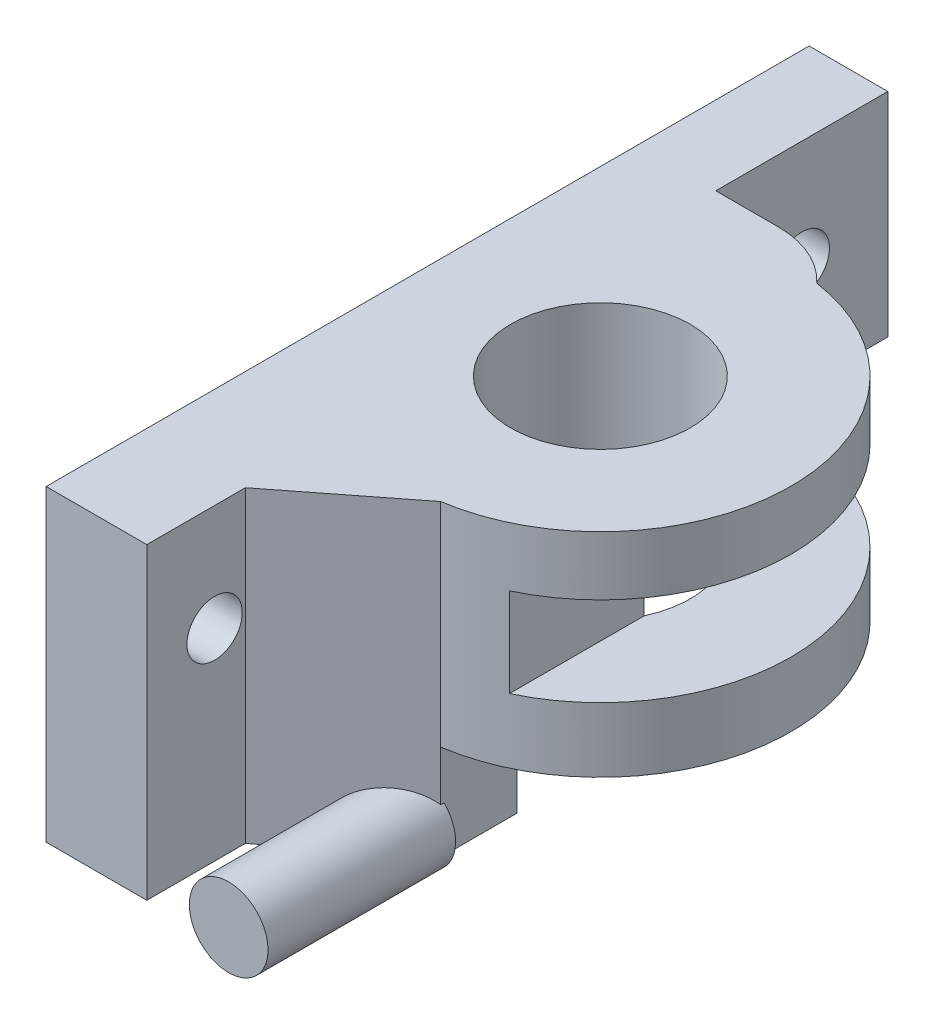
from build123d import *

# Parameters (mm, degrees)
SKETCH_1_R                = 20.68
SKETCH_1_R_2              = 9.68
EXTRUDE_1_DEPTH           = 116.68
SKETCH_11_W               = 27
SKETCH_11_H               = 150
CUT_EXTRUDE_3_DEPTH       = 40
SKETCH_13_W               = 10
SKETCH_13_H               = 128.345013401
CUT_EXTRUDE_7_DEPTH       = 126.614916312
SKETCH_15_W               = 8
SKETCH_15_H               = 68.68
CUT_EXTRUDE_9_DEPTH       = 48
SKETCH_16_W               = 15.549431524
SKETCH_16_H               = 20
SKETCH_16_W_2             = 15.459431524
EXTRUDE_4_DEPTH           = 19.2
SKETCH_17_W               = 19.20851187
SKETCH_17_H               = 14.03
CUT_EXTRUDE_10_DEPTH      = 20.2
SKETCH_18_R               = 9.59
CUT_EXTRUDE_11_DEPTH      = 121.289430957
SKETCH_21_R               = 2.985
CUT_EXTRUDE_12_DEPTH      = 55.2
EXTRUDE_START             = 55.2
SKETCH_24_R               = 20.59
SKETCH_24_R_2             = 9.59
EXTRUDE_2_DEPTH           = 55.2
CUT_EXTRUDE_13_DEPTH      = 55.2
SKETCH_26_W               = 10.00851187
SKETCH_26_H               = 41.68
CUT_EXTRUDE_15_DEPTH      = 55.2
SKETCH_27_W               = 10
SKETCH_27_H               = 40
CUT_EXTRUDE_16_DEPTH      = 55.2
SKETCH_28_W               = 44.880694938
SKETCH_28_H               = 9.608044066
CUT_EXTRUDE_17_DEPTH      = 12.2
SKETCH_35_W               = 13.53
SKETCH_35_H               = 20
EXTRUDE_10_DEPTH          = 15
EXTRUDE_11_DEPTH          = 15
SKETCH_37_W               = 9
SKETCH_37_H               = 20
EXTRUDE_12_DEPTH          = 20
SKETCH_38_W               = 9
SKETCH_38_H               = 20
EXTRUDE_13_DEPTH          = 20
SKETCH_42_R               = 2.985
CUT_EXTRUDE_21_DEPTH      = 20
CUT_EXTRUDE_23_DEPTH      = 138.235841092
SKETCH_45_W               = 3
SKETCH_45_H               = 20
EXTRUDE_14_DEPTH          = 30
SKETCH_46_W               = 3
SKETCH_46_H               = 20
EXTRUDE_15_DEPTH          = 30
SKETCH_47_W               = 33.078221107
SKETCH_47_H               = 20
EXTRUDE_16_DEPTH          = 50
SKETCH_48_W               = 30
SKETCH_48_H               = 20
EXTRUDE_17_DEPTH          = 50
SKETCH_50_W               = 50
SKETCH_50_H               = 20
EXTRUDE_18_DEPTH          = 1
SKETCH_51_W               = 50
SKETCH_51_H               = 20
EXTRUDE_19_DEPTH          = 1
SKETCH_52_W               = 53
SKETCH_52_H               = 14
CUT_EXTRUDE_24_DEPTH      = 151.972575738
SKETCH_53_W               = 53
SKETCH_53_H               = 14
CUT_EXTRUDE_25_DEPTH      = 151.942387436
SKETCH_54_W               = 40
SKETCH_54_H               = 73.27
CUT_EXTRUDE_26_DEPTH      = 147.866192927
SKETCH_56_W               = 13.00851187
SKETCH_56_H               = 20
EXTRUDE_21_DEPTH          = 3.08
SKETCH_60_W               = 6.504255935
SKETCH_60_H               = 76.35
CUT_EXTRUDE_30_DEPTH      = 137.106994034
CUT_EXTRUDE_32_DEPTH      = 20
SKETCH_64_W               = 16.20851187
SKETCH_64_H               = 0.09
EXTRUDE_22_DEPTH          = 20
SKETCH_65_W               = 3.495744065
SKETCH_65_H               = 3.26
CUT_EXTRUDE_33_DEPTH      = 137.057988464
SKETCH_66_W               = 3.495744065
SKETCH_66_H               = 1.776778893
SKETCH_66_W_2             = 3.503635083
SKETCH_66_H_2             = 1.775
EXTRUDE_23_DEPTH          = 20.2
SKETCH_68_W               = 6.504255935
SKETCH_68_H               = 3.66
CUT_EXTRUDE_34_DEPTH      = 20
SKETCH_69_R               = 2.985
CUT_EXTRUDE_35_DEPTH      = 126.598983893
SKETCH_70_R               = 2.985
CUT_EXTRUDE_36_DEPTH      = 132.360728238
SKETCH_71_W               = 38.005321573
SKETCH_71_H               = 111.965885132
CUT_EXTRUDE_37_DEPTH      = 147.475577566
SKETCH_72_R               = 9.7
CUT_EXTRUDE_38_DEPTH      = 38.185254838
CUT_EXTRUDE_START         = -22
SKETCH_77_R               = 30.59
SKETCH_77_R_2             = 20.59
CUT_EXTRUDE_2_DEPTH       = 22
SKETCH_78_W               = 34.816185151
SKETCH_78_H               = 22.96559116
EXTRUDE_26_DEPTH          = 0.1
SKETCH_80_W               = 2.900031179
SKETCH_80_H               = 6.148706656
EXTRUDE_28_DEPTH          = 23.1
SKETCH_81_W               = 6.148706656
SKETCH_81_H               = 23.1
EXTRUDE_29_DEPTH          = 14.1
SKETCH_82_W               = 6.148706656
SKETCH_82_H               = 0.13440884
CUT_EXTRUDE_39_DEPTH      = 19.1
SKETCH_83_W               = 2.900031179
SKETCH_83_H               = 22.96559116
EXTRUDE_30_DEPTH          = 19.1
FILLET_1_R                = 10
SKETCH_84_W               = 3.5
SKETCH_84_H               = 19.1
EXTRUDE_31_DEPTH          = 23.1
SKETCH_85_W               = 3.5
SKETCH_85_H               = 0.52
CUT_EXTRUDE_40_DEPTH      = 48.860163141
SKETCH_86_W               = 3.5
SKETCH_86_H               = 22.96559116
EXTRUDE_32_DEPTH          = 62.1
SKETCH_87_W               = 3.60851187
SKETCH_87_H               = 34.816185151
CUT_EXTRUDE_41_DEPTH      = 62.1
SKETCH_89_W               = 0.10851187
SKETCH_89_H               = 6.15
EXTRUDE_33_DEPTH          = 23.1
EXTRUDE_34_DEPTH          = 22.1
SKETCH_91_W               = 0.971561636
SKETCH_91_H               = 22.96559116
CUT_EXTRUDE_42_DEPTH      = 22.1
SKETCH_95_W               = 6.15
SKETCH_95_H               = 22.96559116
EXTRUDE_35_DEPTH          = 14.1
FILLET_2_R                = 10
SKETCH_96_W               = 3.60851187
SKETCH_96_H               = 2.548438364
CUT_EXTRUDE_43_DEPTH      = 55.35700885
SKETCH_97_W               = 3.5
SKETCH_97_H               = 6.148706656
EXTRUDE_36_DEPTH          = 23.1
CUT_EXTRUDE_44_DEPTH      = 23.1
SKETCH_99_W               = 6.15
SKETCH_99_H               = 0.13440884
CUT_EXTRUDE_45_DEPTH      = 23.1
SKETCH_101_R              = 2.985
CUT_EXTRUDE_46_DEPTH      = 23.1
SKETCH_103_W              = 3.60851187
SKETCH_103_H              = 0.54
CUT_EXTRUDE_49_DEPTH      = 53.222714265
SKETCH_104_W              = 3.60851187
SKETCH_104_H              = 0.54
CUT_EXTRUDE_50_DEPTH      = 53.222714265
SKETCH_105_W              = 14.1
SKETCH_105_H              = 22.96559116
EXTRUDE_37_DEPTH          = 30
SKETCH_106_W              = 8.260608777
SKETCH_106_H              = 22.96559116
CUT_EXTRUDE_52_DEPTH      = 61.301547389
SKETCH_107_R              = 2.985
CUT_EXTRUDE_53_DEPTH      = 54.964080882
SKETCH_108_W              = 3.60851187
SKETCH_108_H              = 22.96559116
EXTRUDE_38_DEPTH          = 40
SKETCH_109_W              = 84.280268292
SKETCH_109_H              = 22.96559116
EXTRUDE_39_DEPTH          = 5
SKETCH_110_R              = 2.985
CUT_EXTRUDE_54_DEPTH      = 57.152183688
SKETCH_111_R              = 2.985
CUT_EXTRUDE_55_DEPTH      = 50.299169813
CUT_EXTRUDE_56_DEPTH      = 53.222714265
EXTRUDE_40_DEPTH          = 10.3
EXTRUDE_44_DEPTH          = 0.01
EXTRUDE_44_DEPTH_BACK     = 30.01
SKETCH_120_R              = 4.25
CUT_EXTRUDE_58_DEPTH      = 60.346587307
CUT_EXTRUDE_58_DEPTH_BACK = 60.346587307
SKETCH_121_W              = 49.202417837
SKETCH_121_H              = 14.707819526


with BuildPart() as part:
    # 草圖1 → 伸長-薄件1 (new body)
    with BuildSketch(Plane(origin=(0, 0, 0), x_dir=(1, 0, 0), z_dir=(0, 1, 0))):
        Circle(SKETCH_1_R)
        Circle(SKETCH_1_R_2, mode=Mode.SUBTRACT)
    extrude(amount=EXTRUDE_1_DEPTH)

    # 草圖11 → 除料-伸長3 (cut)
    with BuildSketch(Plane(origin=(0, 116.68, 0), x_dir=(1, 0, 0), z_dir=(0, 1, 0))):
        with Locations((21.70851187, -44.235815192)):
            Rectangle(SKETCH_11_W, SKETCH_11_H)
    extrude(amount=-CUT_EXTRUDE_3_DEPTH, mode=Mode.SUBTRACT)

    # 草圖13 → 除料-伸長7 (cut, through all)
    with BuildSketch(Plane.XY.offset(21)):
        with Locations((-16, 58.612182466)):
            Rectangle(SKETCH_13_W, SKETCH_13_H)
    extrude(amount=-CUT_EXTRUDE_7_DEPTH, mode=Mode.SUBTRACT)

    # 草圖15 → 除料-伸長9 (cut)
    with BuildSketch(Plane.XY.offset(21)):
        with Locations((-1.395744065, 52.34)):
            Rectangle(SKETCH_15_W, SKETCH_15_H)
    extrude(amount=-CUT_EXTRUDE_9_DEPTH, mode=Mode.SUBTRACT)

    # 草圖16 → 填料-伸長4 (add)
    with BuildSketch(Plane(origin=(8.20851187, 0, 0), x_dir=(0, 0, -1), z_dir=(1, 0, 0))):
        with Locations((12.905284238, 106.68)):
            Rectangle(SKETCH_16_W, SKETCH_16_H)
        with Locations((-12.860284238, 106.68)):
            Rectangle(SKETCH_16_W_2, SKETCH_16_H)
    extrude(amount=-EXTRUDE_4_DEPTH)

    # 草圖17 → 除料-伸長10 (cut)
    with BuildSketch(Plane(origin=(0, 116.68, 0), x_dir=(1, 0, 0), z_dir=(0, 1, 0))):
        with Locations((-1.395744065, -0.045)):
            Rectangle(SKETCH_17_W, SKETCH_17_H)
    extrude(amount=-CUT_EXTRUDE_10_DEPTH, mode=Mode.SUBTRACT)

    # 草圖18 → 除料-伸長11 (cut, through all)
    with BuildSketch(Plane.XZ):
        with Locations(Location((0, 0, 0), (0, 0, 90))):
            Circle(SKETCH_18_R)
    extrude(amount=-CUT_EXTRUDE_11_DEPTH, mode=Mode.SUBTRACT)

    # 草圖21 → 除料-伸長12 (cut)
    with BuildSketch(Plane(origin=(0, 0, -20.68), x_dir=(-1, 0, 0), z_dir=(0, 0, -1))):
        with Locations((1.39148813, 108.73)):
            Circle(SKETCH_21_R)
    extrude(amount=-CUT_EXTRUDE_12_DEPTH, mode=Mode.SUBTRACT)

    # 草圖24 → 伸長-薄件2 (add)
    with BuildSketch(Plane.XZ.offset(EXTRUDE_START)):
        Circle(SKETCH_24_R)
        Circle(SKETCH_24_R_2, mode=Mode.SUBTRACT)
    extrude(amount=-EXTRUDE_2_DEPTH)

    # 草圖25 → 除料-伸長13 (cut)
    with BuildSketch(Plane.XY.offset(21)):
        Polygon((-1.39148813, -11.785), (22.612379708, -11.785), (22.612379708, -63.873337429), (-22.749525245, -63.873337429), (-22.749525245, -11.785), align=None)
    extrude(amount=-CUT_EXTRUDE_13_DEPTH, mode=Mode.SUBTRACT)

    # 草圖26 → 除料-伸長15 (cut)
    with BuildSketch(Plane(origin=(0, 0, 0), x_dir=(1, 0, 0), z_dir=(0, 1, 0))):
        with Locations((-15.995744065, -0.16)):
            Rectangle(SKETCH_26_W, SKETCH_26_H)
    extrude(amount=-CUT_EXTRUDE_15_DEPTH, mode=Mode.SUBTRACT)

    # 草圖27 → 除料-伸長16 (cut)
    with BuildSketch(Plane(origin=(21, 0, 0), x_dir=(0, 0, -1), z_dir=(1, 0, 0))):
        with Locations((0, 41.68)):
            Rectangle(SKETCH_27_W, SKETCH_27_H)
    extrude(amount=-CUT_EXTRUDE_16_DEPTH, mode=Mode.SUBTRACT)

    # 草圖28 → 除料-伸長17 (cut)
    with BuildSketch(Plane(origin=(21, 0, 0), x_dir=(0, 0, -1), z_dir=(1, 0, 0))):
        Rectangle(SKETCH_28_W, SKETCH_28_H)
    extrude(amount=-CUT_EXTRUDE_17_DEPTH, mode=Mode.SUBTRACT)

    # 草圖35 → 填料-伸長10 (add)
    with BuildSketch(Plane.ZY.offset(10.99148813)):
        with Locations((13.825, 106.68)):
            Rectangle(SKETCH_35_W, SKETCH_35_H)
    extrude(amount=EXTRUDE_10_DEPTH)

    # 草圖36 → 填料-伸長11 (add)
    with BuildSketch(Plane.ZY.offset(10.99148813)):
        Polygon((-20.68, 116.68), (-6.97, 116.68), (-6.97, 96.48), (-20.68, 96.68), align=None)
    extrude(amount=EXTRUDE_11_DEPTH)

    # 草圖37 → 填料-伸長12 (add)
    with BuildSketch(Plane.XY.offset(20.59)):
        with Locations((-21.49148813, 106.68)):
            Rectangle(SKETCH_37_W, SKETCH_37_H)
    extrude(amount=EXTRUDE_12_DEPTH)

    # 草圖38 → 填料-伸長13 (add)
    with BuildSketch(Plane(origin=(0, 0, -20.68), x_dir=(-1, 0, 0), z_dir=(0, 0, -1))):
        with Locations((21.49148813, 106.68)):
            Rectangle(SKETCH_38_W, SKETCH_38_H)
    extrude(amount=EXTRUDE_13_DEPTH)

    # 草圖42 → 除料-伸長21 (cut)
    with BuildSketch(Plane(origin=(-16.99148813, 0, 0), x_dir=(0, 0, -1), z_dir=(1, 0, 0))):
        with Locations((30.68, 106.554418142)):
            Circle(SKETCH_42_R)
        with Locations((-30.395640125, 106.68)):
            Circle(SKETCH_42_R)
    extrude(amount=-CUT_EXTRUDE_21_DEPTH, mode=Mode.SUBTRACT)

    # 草圖43 → 除料-伸長23 (cut, through all)
    with BuildSketch(Plane(origin=(0, 116.68, 0), x_dir=(1, 0, 0), z_dir=(0, 1, 0))):
        Polygon((-11, 6.97), (-10.99148813, 20.68), (-10.99148813, 48.096794253), (-28.274756234, 48.096794253), (-28.274756234, -43.270506289), (-11, -43.270506289), align=None)
    extrude(amount=-CUT_EXTRUDE_23_DEPTH, mode=Mode.SUBTRACT)

    # 草圖45 → 填料-伸長14 (add)
    with BuildSketch(Plane.XY.offset(20.59)):
        with Locations((-9.5, 106.68)):
            Rectangle(SKETCH_45_W, SKETCH_45_H)
    extrude(amount=EXTRUDE_14_DEPTH)

    # 草圖46 → 填料-伸長15 (add)
    with BuildSketch(Plane(origin=(0, 0, -20.68), x_dir=(-1, 0, 0), z_dir=(0, 0, -1))):
        with Locations((9.49148813, 106.68)):
            Rectangle(SKETCH_46_W, SKETCH_46_H)
    extrude(amount=EXTRUDE_15_DEPTH)

    # 草圖47 → 填料-伸長16 (add)
    with BuildSketch(Plane.ZY.offset(11)):
        with Locations((34.050889447, 106.68)):
            Rectangle(SKETCH_47_W, SKETCH_47_H)
    extrude(amount=EXTRUDE_16_DEPTH)

    # 草圖48 → 填料-伸長17 (add)
    with BuildSketch(Plane.ZY.offset(10.99148813)):
        with Locations((-35.68, 106.68)):
            Rectangle(SKETCH_48_W, SKETCH_48_H)
    extrude(amount=EXTRUDE_17_DEPTH)

    # 草圖50 → 填料-伸長18 (add)
    with BuildSketch(Plane(origin=(0, 0, 17.511778893), x_dir=(-1, 0, 0), z_dir=(0, 0, -1))):
        with Locations((36, 106.68)):
            Rectangle(SKETCH_50_W, SKETCH_50_H)
    extrude(amount=EXTRUDE_18_DEPTH)

    # 草圖51 → 填料-伸長19 (add)
    with BuildSketch(Plane.XY.offset(-20.68)):
        with Locations((-35.99148813, 106.68)):
            Rectangle(SKETCH_51_W, SKETCH_51_H)
    extrude(amount=EXTRUDE_19_DEPTH)

    # 草圖52 → 除料-伸長24 (cut, through all)
    with BuildSketch(Plane(origin=(0, 116.68, 0), x_dir=(1, 0, 0), z_dir=(0, 1, 0))):
        with Locations((-34.49148813, 43.68)):
            Rectangle(SKETCH_52_W, SKETCH_52_H)
    extrude(amount=-CUT_EXTRUDE_24_DEPTH, mode=Mode.SUBTRACT)

    # 草圖53 → 除料-伸長25 (cut, through all)
    with BuildSketch(Plane(origin=(0, 116.68, 0), x_dir=(1, 0, 0), z_dir=(0, 1, 0))):
        with Locations((-34.5, -43.59)):
            Rectangle(SKETCH_53_W, SKETCH_53_H)
    extrude(amount=-CUT_EXTRUDE_25_DEPTH, mode=Mode.SUBTRACT)

    # 草圖54 → 除料-伸長26 (cut, through all)
    with BuildSketch(Plane(origin=(0, 116.68, 0), x_dir=(1, 0, 0), z_dir=(0, 1, 0))):
        with Locations((-41, 0.045)):
            Rectangle(SKETCH_54_W, SKETCH_54_H)
    extrude(amount=-CUT_EXTRUDE_26_DEPTH, mode=Mode.SUBTRACT)

    # 草圖56 → 填料-伸長21 (add)
    with BuildSketch(Plane(origin=(0, 0, -36.68), x_dir=(-1, 0, 0), z_dir=(0, 0, -1))):
        with Locations((14.495744065, 106.68)):
            Rectangle(SKETCH_56_W, SKETCH_56_H)
    extrude(amount=EXTRUDE_21_DEPTH)

    # 草圖60 → 除料-伸長30 (cut, through all)
    with BuildSketch(Plane(origin=(0, 116.68, 0), x_dir=(1, 0, 0), z_dir=(0, 1, 0))):
        with Locations((-17.747872032, 1.585)):
            Rectangle(SKETCH_60_W, SKETCH_60_H)
    extrude(amount=-CUT_EXTRUDE_30_DEPTH, mode=Mode.SUBTRACT)

    # 草圖61 → 除料-伸長32 (cut)
    with BuildSketch(Plane(origin=(0, 116.68, 0), x_dir=(1, 0, 0), z_dir=(0, 1, 0))):
        Polygon((1.92725193, -20.59), (1.92725193, -22.399121663), (-2.174190472, -21.421542421), (-2.174190472, -20.59), align=None)
    extrude(amount=-CUT_EXTRUDE_32_DEPTH, mode=Mode.SUBTRACT)

    # 草圖64 → 填料-伸長22 (add)
    with BuildSketch(Plane(origin=(0, 116.68, 0), x_dir=(1, 0, 0), z_dir=(0, 1, 0))):
        with Locations((0.104255935, -20.635)):
            Rectangle(SKETCH_64_W, SKETCH_64_H)
    extrude(amount=-EXTRUDE_22_DEPTH)

    # 草圖65 → 除料-伸長33 (cut, through all)
    with BuildSketch(Plane(origin=(0, 116.68, 0), x_dir=(1, 0, 0), z_dir=(0, 1, 0))):
        with Locations((-12.747872033, -18.141778893)):
            Rectangle(SKETCH_65_W, SKETCH_65_H)
    extrude(amount=-CUT_EXTRUDE_33_DEPTH, mode=Mode.SUBTRACT)

    # 草圖66 → 填料-伸長23 (add)
    with BuildSketch(Plane(origin=(0, 96.48, 0), x_dir=(1, 0, 0), z_dir=(0, 1, 0))):
        with Locations((-12.747872033, -18.883389447)):
            Rectangle(SKETCH_66_W, SKETCH_66_H)
        with Locations((-12.743926524, 18.7925)):
            Rectangle(SKETCH_66_W_2, SKETCH_66_H_2)
    extrude(amount=EXTRUDE_23_DEPTH)

    # 草圖68 → 除料-伸長34 (cut)
    with BuildSketch(Plane(origin=(0, 116.68, 0), x_dir=(1, 0, 0), z_dir=(0, 1, 0))):
        with Locations((-11.243616098, 37.93)):
            Rectangle(SKETCH_68_W, SKETCH_68_H)
    extrude(amount=-CUT_EXTRUDE_34_DEPTH, mode=Mode.SUBTRACT)

    # 草圖69 → 除料-伸長35 (cut, through all)
    with BuildSketch(Plane(origin=(-7.99148813, 0, 0), x_dir=(0, 0, -1), z_dir=(1, 0, 0))):
        with Locations((28.39, 106.68)):
            Circle(SKETCH_69_R)
        with Locations((-28.635, 106.68)):
            Circle(SKETCH_69_R)
    extrude(amount=-CUT_EXTRUDE_35_DEPTH, mode=Mode.SUBTRACT)

    # 草圖70 → 除料-伸長36 (cut, through all)
    with BuildSketch(Plane(origin=(0, 0, 20.59), x_dir=(-1, 0, 0), z_dir=(0, 0, -1))):
        with Locations((1.39148813, 108.73)):
            Circle(SKETCH_70_R)
    extrude(amount=-CUT_EXTRUDE_36_DEPTH, mode=Mode.SUBTRACT)

    # 草圖71 → 除料-伸長37 (cut, through all)
    with BuildSketch(Plane.XY.offset(50)):
        with Locations((2.76131712, 67.163533726)):
            Rectangle(SKETCH_71_W, SKETCH_71_H)
    extrude(amount=-CUT_EXTRUDE_37_DEPTH, mode=Mode.SUBTRACT)

    # 草圖72 → 除料-伸長38 (cut, through all)
    with BuildSketch(Plane.XZ.offset(11.785)):
        with Locations(Location((0, 0, 0), (0, 0, 270))):
            Circle(SKETCH_72_R)
    extrude(amount=-CUT_EXTRUDE_38_DEPTH, mode=Mode.SUBTRACT)

    # 草圖77 → 除料-伸長-薄件2 (cut)
    with BuildSketch(Plane(origin=(0, 11.18059116, 0), x_dir=(1, 0, 0), z_dir=(0, 1, 0)).offset(CUT_EXTRUDE_START)):
        Circle(SKETCH_77_R)
        Circle(SKETCH_77_R_2, mode=Mode.SUBTRACT)
    extrude(amount=CUT_EXTRUDE_2_DEPTH, mode=Mode.SUBTRACT)

    # 草圖78 → 填料-伸長26 (add)
    with BuildSketch(Plane.ZY.offset(11)):
        with Locations((-0.002688243, -0.30220442)):
            Rectangle(SKETCH_78_W, SKETCH_78_H)
    extrude(amount=EXTRUDE_26_DEPTH)



with BuildPart() as body_2:
    # 草圖80 → 填料-伸長28 (new body)
    with BuildSketch(Plane.XZ.offset(11.785)):
        with Locations((-12.55001559, -20.485134146)):
            Rectangle(SKETCH_80_W, SKETCH_80_H)
    extrude(amount=-EXTRUDE_28_DEPTH)


with BuildPart() as part_1:
    add(part.part)

    add(body_2.part)  # 填料-伸長29 merges body 2
    # 草圖81 → 填料-伸長29 (add)
    with BuildSketch(Plane(origin=(-11.1, 0, 0), x_dir=(0, 0, -1), z_dir=(1, 0, 0))):
        with Locations((20.485134146, -0.235)):
            Rectangle(SKETCH_81_W, SKETCH_81_H)
    extrude(amount=EXTRUDE_29_DEPTH)

    # 草圖82 → 除料-伸長39 (cut)
    with BuildSketch(Plane(origin=(3, 0, 0), x_dir=(0, 0, -1), z_dir=(1, 0, 0))):
        with Locations((20.485134146, 11.24779558)):
            Rectangle(SKETCH_82_W, SKETCH_82_H)
    extrude(amount=-CUT_EXTRUDE_39_DEPTH, mode=Mode.SUBTRACT)

    # 草圖83 → 填料-伸長30 (add)
    with BuildSketch(Plane.XY.offset(-17.410780818)):
        with Locations((-12.55001559, -0.30220442)):
            Rectangle(SKETCH_83_W, SKETCH_83_H)
    extrude(amount=-EXTRUDE_30_DEPTH)

    # 圓角1
    # the kernel refuses this fillet: 10 mm, written as the material it takes off along each edge
    with BuildSketch(Plane(origin=(3, -30.090254449, -23.559487474), x_dir=(-1, 0, 0), z_dir=(0, 1, 0))) as fillet_1_piece_1:
        with BuildLine():
            CenterArc((7.32210178, 10), FILLET_1_R, 222.927997508, 47.072002492)
            Line((0, 3.189212562), (-0.146442036, 3.052996813))
            ThreePointArc((-0.146442036, 3.052996813), (-0.2, 1.594606281), (-0.2, 0))
            Line((-0.2, 0), (0, -0.2))
            Line((0, -0.2), (7.32210178, -0.2))
            Line((7.32210178, -0.2), (7.32210178, 0))
        make_face()
    extrude(amount=59.576100059, mode=Mode.SUBTRACT)

    # 草圖84 → 填料-伸長31 (add)
    with BuildSketch(Plane(origin=(0, -11.785, 0), x_dir=(-1, 0, 0), z_dir=(0, -1, 0))):
        with Locations((12.85, 26.960780818)):
            Rectangle(SKETCH_84_W, SKETCH_84_H)
    extrude(amount=-EXTRUDE_31_DEPTH)

    # 草圖85 → 除料-伸長40 (cut, through all)
    with BuildSketch(Plane.XZ.offset(11.785)):
        with Locations((-12.85, -36.250780818)):
            Rectangle(SKETCH_85_W, SKETCH_85_H)
    extrude(amount=-CUT_EXTRUDE_40_DEPTH, mode=Mode.SUBTRACT)

    # 草圖86 → 填料-伸長32 (add)
    with BuildSketch(Plane.XY.offset(-17.410780818)):
        with Locations((-12.85, -0.30220442)):
            Rectangle(SKETCH_86_W, SKETCH_86_H)
    extrude(amount=EXTRUDE_32_DEPTH)

    # 草圖87 → 除料-伸長41 (cut)
    with BuildSketch(Plane.XZ.offset(11.785)):
        with Locations((-12.795744065, -0.002688243)):
            Rectangle(SKETCH_87_W, SKETCH_87_H)
    extrude(amount=-CUT_EXTRUDE_41_DEPTH, mode=Mode.SUBTRACT)


with BuildPart() as cut_extrude_41_piece_1:
    # of the separate pieces the step leaves, piece 1, a body of its own (cut_extrude_41_pieces)
    add(part_1.part.solids().sort_by_distance((3, 11.18059116, -20.370274912))[0])



with BuildPart() as cut_extrude_41_piece_2:
    # of the separate pieces the step leaves, piece 2, a body of its own (cut_extrude_41_pieces)
    add(part_1.part.solids().sort_by_distance((-11.1, 11.18059116, 17.405404333))[0])

    # 草圖89 → 填料-伸長33 (add)
    with BuildSketch(Plane.XZ.offset(11.785)):
        with Locations((-11.045744065, 20.485780818)):
            Rectangle(SKETCH_89_W, SKETCH_89_H)
    extrude(amount=-EXTRUDE_33_DEPTH)

    # 草圖90 → 填料-伸長34 (add)
    with BuildSketch(Plane.XY.offset(23.560780818)):
        Polygon((-11, 11.18059116), (-11.1, 11.18059116), (-11.1, -11.785), (-10.99148813, -11.785), (-10.99148813, 11.18059116), align=None)
    extrude(amount=EXTRUDE_34_DEPTH)

    # 草圖91 → 除料-伸長42 (cut)
    with BuildSketch(Plane.ZY.offset(11.1)):
        with Locations((45.175, -0.30220442)):
            Rectangle(SKETCH_91_W, SKETCH_91_H)
    extrude(amount=-CUT_EXTRUDE_42_DEPTH, mode=Mode.SUBTRACT)


with BuildPart() as cut_extrude_41_piece_1_1:
    add(cut_extrude_41_piece_1.part)

    add(cut_extrude_41_piece_2.part)  # 填料-伸長35 merges 除料-伸長41 piece 2
    # 草圖95 → 填料-伸長35 (add)
    with BuildSketch(Plane(origin=(-10.99148813, 0, 0), x_dir=(0, 0, -1), z_dir=(1, 0, 0))):
        with Locations((-20.485780818, -0.30220442)):
            Rectangle(SKETCH_95_W, SKETCH_95_H)
    extrude(amount=EXTRUDE_35_DEPTH)

    # 圓角2
    # the kernel refuses this fillet: 10 mm, written as the material it takes off along each edge
    with BuildSketch(Plane(origin=(3.10851187, -30.131013506, 23.560780818), x_dir=(-1, 0, 0), z_dir=(0, 1, 0))) as fillet_2_piece_1:
        with BuildLine():
            CenterArc((7.338405402, -10), FILLET_2_R, 90, 47.209333859)
            Line((0, -3.206782342), (-0.146768108, -3.070917989))
            ThreePointArc((-0.146768108, -3.070917989), (-0.2, -1.603391171), (-0.2, 0))
            Line((-0.2, 0), (0, 0.2))
            Line((0, 0.2), (7.338405402, 0.2))
            Line((7.338405402, 0.2), (7.338405402, 0))
        make_face()
    extrude(amount=59.657618171, mode=Mode.SUBTRACT)

    # 草圖96 → 除料-伸長43 (cut, through all)
    with BuildSketch(Plane.XZ.offset(11.785)):
        with Locations((-12.795744065, 43.415)):
            Rectangle(SKETCH_96_W, SKETCH_96_H)
    extrude(amount=-CUT_EXTRUDE_43_DEPTH, mode=Mode.SUBTRACT)

    # 草圖97 → 填料-伸長36 (add)
    with BuildSketch(Plane.XZ.offset(11.785)):
        with Locations((-12.85, -39.065134146)):
            Rectangle(SKETCH_97_W, SKETCH_97_H)
    extrude(amount=-EXTRUDE_36_DEPTH)

    # 草圖98 → 除料-伸長44 (cut)
    with BuildSketch(Plane(origin=(-11.1, 0, 0), x_dir=(0, 0, -1), z_dir=(1, 0, 0))):
        Polygon((17.410780818, 11.18059116), (17.410780818, 11.315), (22.198280677, 11.315), (38.461669752, 11.315), (42.139487474, 11.315), (42.139487474, 11.18059116), align=None)
    extrude(amount=-CUT_EXTRUDE_44_DEPTH, mode=Mode.SUBTRACT)

    # 草圖99 → 除料-伸長45 (cut)
    with BuildSketch(Plane(origin=(-10.99148813, 0, 0), x_dir=(0, 0, -1), z_dir=(1, 0, 0))):
        with Locations((-20.485780818, 11.24779558)):
            Rectangle(SKETCH_99_W, SKETCH_99_H)
    extrude(amount=-CUT_EXTRUDE_45_DEPTH, mode=Mode.SUBTRACT)

    # 草圖101 → 除料-伸長46 (cut)
    with BuildSketch(Plane(origin=(-10.99148813, 0, 0), x_dir=(0, 0, -1), z_dir=(1, 0, 0))):
        with Locations((-32.928668636, -0.30220442)):
            Circle(SKETCH_101_R)
        with Locations((32.849487474, -0.30220442)):
            Circle(SKETCH_101_R)
    extrude(amount=-CUT_EXTRUDE_46_DEPTH, mode=Mode.SUBTRACT)

    # 草圖103 → 除料-伸長49 (cut, through all)
    with BuildSketch(Plane(origin=(0, 11.18059116, 0), x_dir=(1, 0, 0), z_dir=(0, 1, 0))):
        with Locations((-12.795744065, -17.675404333)):
            Rectangle(SKETCH_103_W, SKETCH_103_H)
    extrude(amount=-CUT_EXTRUDE_49_DEPTH, mode=Mode.SUBTRACT)

    # 草圖104 → 除料-伸長50 (cut, through all)
    with BuildSketch(Plane(origin=(0, 11.18059116, 0), x_dir=(1, 0, 0), z_dir=(0, 1, 0))):
        with Locations((-12.795744065, 17.680780818)):
            Rectangle(SKETCH_104_W, SKETCH_104_H)
    extrude(amount=-CUT_EXTRUDE_50_DEPTH, mode=Mode.SUBTRACT)

    # 草圖105 → 填料-伸長37 (add)
    with BuildSketch(Plane.XY.offset(50)):
        with Locations((-3.94148813, -0.30220442)):
            Rectangle(SKETCH_105_W, SKETCH_105_H)
    extrude(amount=-EXTRUDE_37_DEPTH)

    # 草圖106 → 除料-伸長52 (cut, through all)
    with BuildSketch(Plane.ZY.offset(10.99148813)):
        with Locations((46.271085207, -0.30220442)):
            Rectangle(SKETCH_106_W, SKETCH_106_H)
    extrude(amount=-CUT_EXTRUDE_52_DEPTH, mode=Mode.SUBTRACT)

    # 草圖107 → 除料-伸長53 (cut, through all)
    with BuildSketch(Plane.ZY.offset(10.99148813)):
        with Locations(Location((32.928668636, -0.30220442, 0), (0, 0, 180))):
            Circle(SKETCH_107_R)
    extrude(amount=-CUT_EXTRUDE_53_DEPTH, mode=Mode.SUBTRACT)

    # 草圖108 → 填料-伸長38 (add)
    with BuildSketch(Plane(origin=(0, 0, 17.945404333), x_dir=(-1, 0, 0), z_dir=(0, 0, -1))):
        with Locations((12.795744065, -0.30220442)):
            Rectangle(SKETCH_108_W, SKETCH_108_H)
    extrude(amount=EXTRUDE_38_DEPTH)

    # 草圖109 → 填料-伸長39 (add)
    with BuildSketch(Plane.ZY.offset(14.6)):
        with Locations((0.000646672, -0.30220442)):
            Rectangle(SKETCH_109_W, SKETCH_109_H)
    extrude(amount=EXTRUDE_39_DEPTH)

    # 草圖110 → 除料-伸長54 (cut, through all)
    with BuildSketch(Plane(origin=(-14.6, 0, 0), x_dir=(0, 0, -1), z_dir=(1, 0, 0))):
        with Locations((32.849487474, -0.30220442)):
            Circle(SKETCH_110_R)
    extrude(amount=-CUT_EXTRUDE_54_DEPTH, mode=Mode.SUBTRACT)

    # 草圖111 → 除料-伸長55 (cut, through all)
    with BuildSketch(Plane(origin=(3.10851187, 0, 0), x_dir=(0, 0, -1), z_dir=(1, 0, 0))):
        with Locations((-32.928668636, -0.30220442)):
            Circle(SKETCH_111_R)
    extrude(amount=-CUT_EXTRUDE_55_DEPTH, mode=Mode.SUBTRACT)

    # 草圖112 → 除料-伸長56 (cut, through all)
    with BuildSketch(Plane(origin=(0, 11.18059116, 0), x_dir=(1, 0, 0), z_dir=(0, 1, 0))):
        Polygon((3.10851187, -20.353998476), (-8.730551994, -29.607339099), (-8.730551994, -42.140780818), (3.10851187, -42.140780818), align=None)
    extrude(amount=-CUT_EXTRUDE_56_DEPTH, mode=Mode.SUBTRACT)

    # 草圖113 → 填料-伸長40 (add)
    with BuildSketch(Plane.XZ.offset(11.785)):
        Polygon((3.10851187, 20.353998476), (-8.730551994, 29.607339099), (-8.730551994, 42.140780818), (-19.6, 42.140780818), (-19.6, 12.089639112), (3.10851187, 12.089639112), align=None)
    extrude(amount=EXTRUDE_40_DEPTH)

    # 草圖120 → 填料-伸長44 (add, two sides: drawn at the far end of the back side and taken through both)
    with BuildSketch(Plane.XY.offset(50).offset(-EXTRUDE_44_DEPTH_BACK)):
        with Locations((0.10851187, -20.185)):
            Circle(SKETCH_120_R)
    extrude(amount=EXTRUDE_44_DEPTH + EXTRUDE_44_DEPTH_BACK)

    # 草圖121 → 除料-伸長58 (cut, two sides: drawn at the far end of the back side and taken through both)
    with BuildSketch(Plane(origin=(0, 0, 0), x_dir=(1, 0, 0), z_dir=(0, 1, 0)).offset(-CUT_EXTRUDE_58_DEPTH_BACK)):
        with Locations((3.140291281, -47.603289382)):
            Rectangle(SKETCH_121_W, SKETCH_121_H)
    extrude(amount=CUT_EXTRUDE_58_DEPTH + CUT_EXTRUDE_58_DEPTH_BACK, mode=Mode.SUBTRACT)


solid = cut_extrude_41_piece_1_1.part
